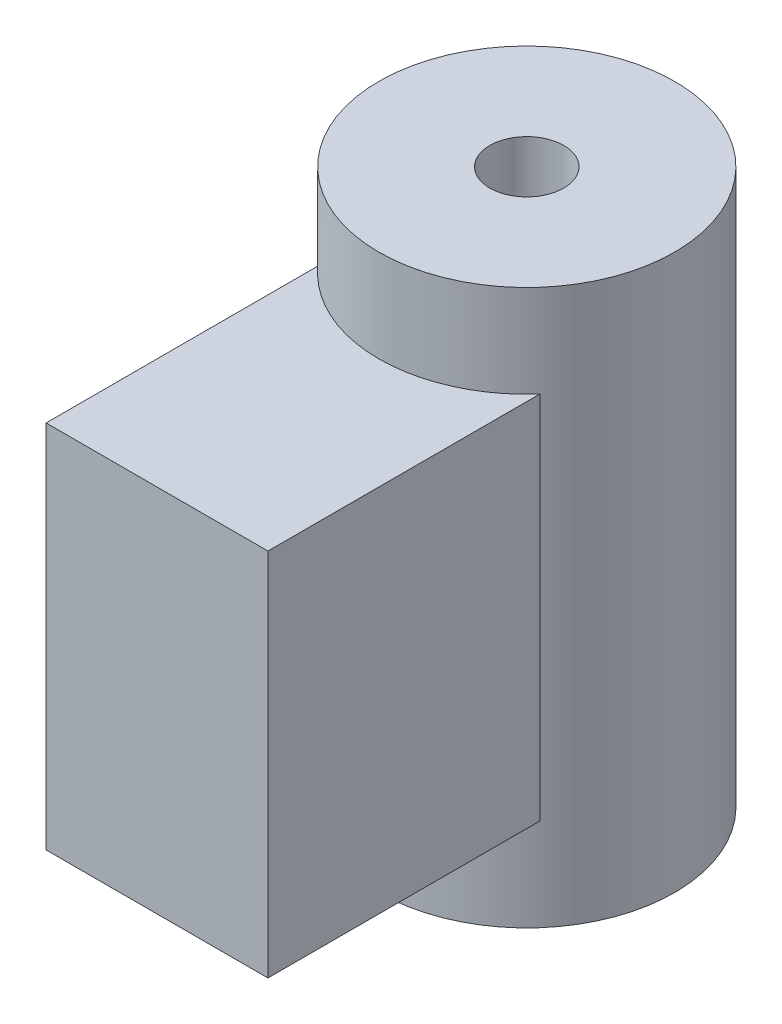
from build123d import *

# Parameters (mm, degrees)
SKETCH_1_R      = 4
SKETCH_1_R_2    = 1
EXTRUDE_1_DEPTH = 7.5
EXTRUDE_2_DEPTH = 5


with BuildPart() as part:
    # Эскиз1 → Бобышка-Вытянуть1 (new, symmetric)
    with BuildSketch(Plane(origin=(0, 0, 0), x_dir=(1, 0, 0), z_dir=(0, 1, 0))):
        Circle(SKETCH_1_R)
        Circle(SKETCH_1_R_2, mode=Mode.SUBTRACT)
    extrude(amount=EXTRUDE_1_DEPTH, both=True)

    # Эскиз3 → Бобышка-Вытянуть2 (add, symmetric)
    with BuildSketch(Plane(origin=(0, 0, 0), x_dir=(1, 0, 0), z_dir=(0, 1, 0))):
        with BuildLine():
            Line((-3, -2.645751311), (-3, -10))
            Line((-3, -10), (3, -10))
            Line((3, -10), (3, -2.645751311))
            ThreePointArc((3, -2.645751311), (0, -4), (-3, -2.645751311))
        make_face()
    extrude(amount=EXTRUDE_2_DEPTH, both=True)


solid = part.part
